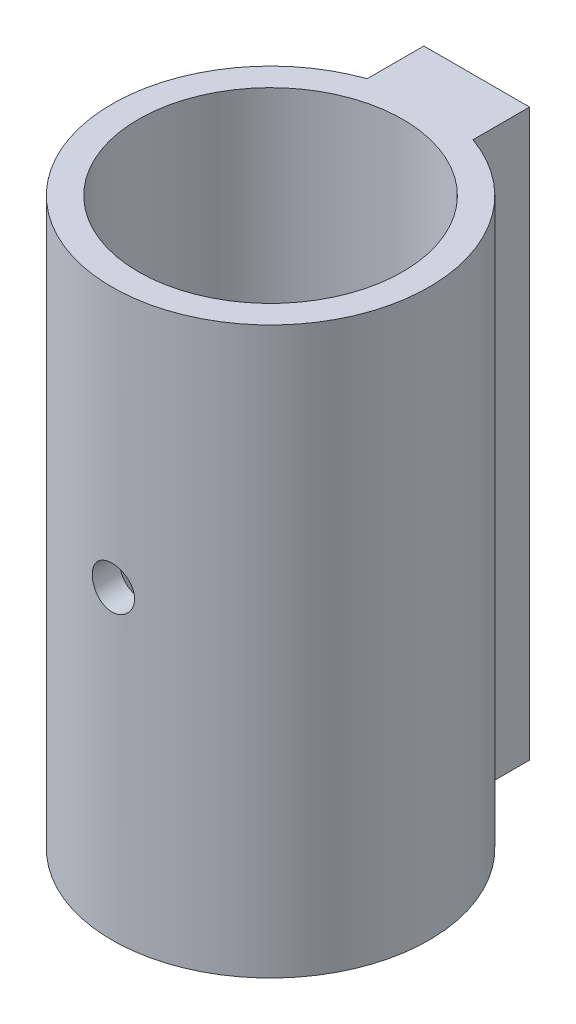
from build123d import *

# Parameters (mm, degrees)
BOSS_EXTRUDE1_DEPTH = 21.4
SKETCH3_R           = 5
CUT_EXTRUDE1_DEPTH  = 24.9
SKETCH4_R           = 1.99
CUT_EXTRUDE2_DEPTH  = 2
SKETCH5_R           = 0.8
CUT_EXTRUDE3_DEPTH  = 26.16346558


with BuildPart() as part:
    # Sketch2 → Boss-Extrude1 (new body)
    with BuildSketch(Plane(origin=(0, 0, 0), x_dir=(1, 0, 0), z_dir=(0, 1, 0))):
        with BuildLine():
            Line((0, 7.8), (-2, 7.8))
            Line((-2, 7.8), (-2, 5.656854249))
            ThreePointArc((-2, 5.656854249), (0, -6), (2, 5.656854249))
            Line((2, 5.656854249), (2, 7.8))
            Line((2, 7.8), (0, 7.8))
        make_face()
    extrude(amount=BOSS_EXTRUDE1_DEPTH)

    # Sketch3 → Cut-Extrude1 (cut)
    with BuildSketch(Plane(origin=(0, 21.4, 0), x_dir=(1, 0, 0), z_dir=(0, 1, 0))):
        Circle(SKETCH3_R)
    extrude(amount=-CUT_EXTRUDE1_DEPTH, mode=Mode.SUBTRACT)

    # Sketch4 → Cut-Extrude2 (cut)
    with BuildSketch(Plane(origin=(0, 0, -7.8), x_dir=(-1, 0, 0), z_dir=(0, 0, -1))):
        with Locations((0, 11.554448974)):
            Circle(SKETCH4_R)
    extrude(amount=-CUT_EXTRUDE2_DEPTH, mode=Mode.SUBTRACT)

    # Sketch5 → Cut-Extrude3 (cut, through all)
    with BuildSketch(Plane(origin=(0, 0, -5.8), x_dir=(-1, 0, 0), z_dir=(0, 0, -1))):
        with Locations((0, 11.554448974)):
            Circle(SKETCH5_R)
    extrude(amount=-CUT_EXTRUDE3_DEPTH, mode=Mode.SUBTRACT)


solid = part.part
